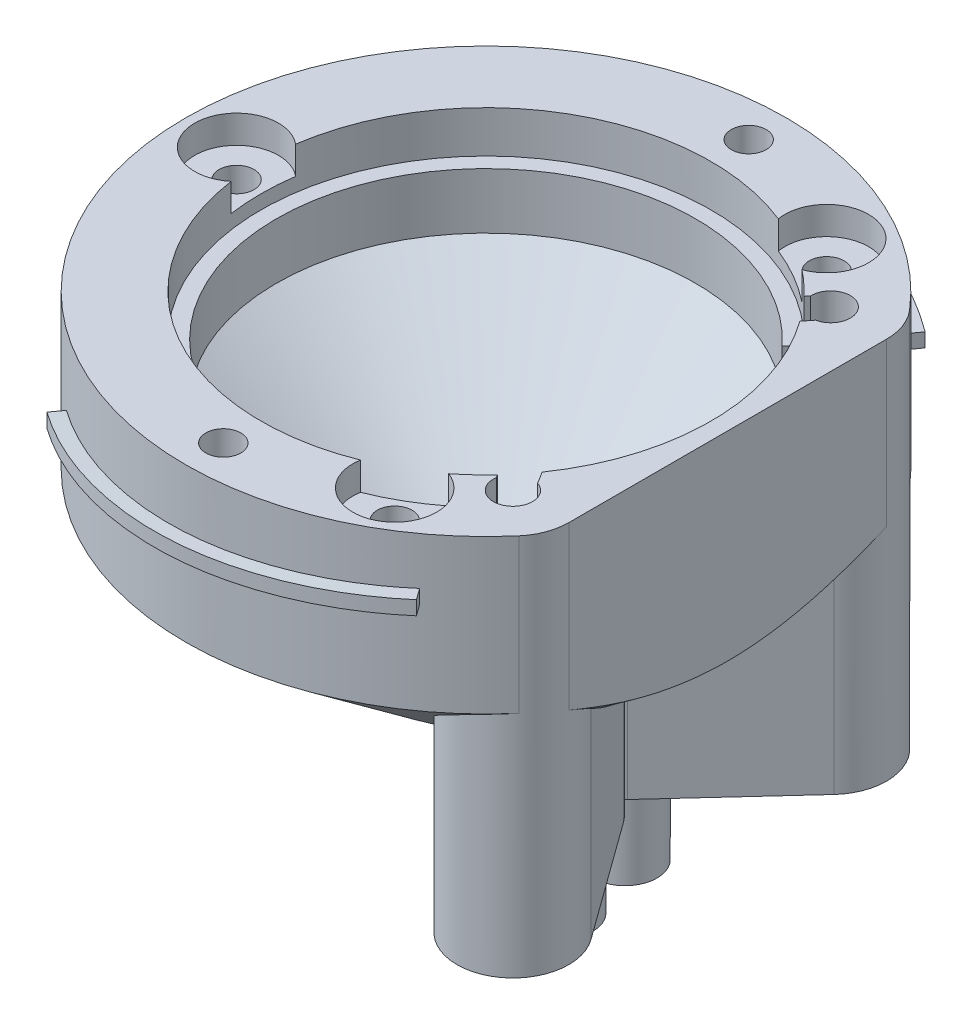
from build123d import *
from build123d.topology import SkipClean

# Parameters (mm, degrees)
CANNULA_SLEEVE_INNER_DIA_R    = 1.145
CANNULA_SLEEVE_INNER_DIA_R_2  = 0.345
OUTPUT_CANNULA_SLEEVE_DEPTH   = 4
OUTPUT_CANNULA_SLEEVE_2_DEPTH = 4
SKETCH3_R                     = 0.345
BOSS_EXTRUDE1_DEPTH           = 1
SKETCH5_R                     = 0.7
CUT_EXTRUDE1_DEPTH            = 0.25
SKETCH28_R                    = 0.5
SKETCH28_R_2                  = 0.345
BOSS_EXTRUDE9_DEPTH           = 2
BOSS_EXTRUDE3_DEPTH           = 3.5
BOSS_EXTRUDE8_START           = -1.2
BOSS_EXTRUDE8_DEPTH           = 0.8
CUT_EXTRUDE2_START            = 1.999997
SKETCH4_R                     = 0.7
SKETCH4_R_2                   = 0.345
CUT_EXTRUDE2_DEPTH            = 5.493648
BOSS_EXTRUDE5_REACH           = 27.822
SKETCH16_R                    = 8.05
CUT_EXTRUDE5_DEPTH            = 1.5
CUT_EXTRUDE12_DEPTH           = 26.821834534
BOSS_EXTRUDE12_DEPTH          = 5.5
BOSS_EXTRUDE10_DEPTH          = 0.6
CUT_EXTRUDE4_REACH            = 30.007
SKETCH18_2_R                  = 0.625
SKETCH18_R                    = 1.5
SKETCH18_R_2                  = 0.625
CUT_EXTRUDE10_DEPTH           = 1
CIRPATTERN1_COUNT             = 3
SWEEP1_PITCH                  = 4
CIRPATTERN4_COUNT             = 2
FILLET1_R                     = 1
FILLET2_R                     = 1
CUT_SWEEP3_PITCH              = 4
CUT_SWEEP3_TO                 = 2.5
CIRPATTERN5_COUNT             = 2
CUT_REVOLVE1_START            = -14
CUT_REVOLVE1_DEPTH            = 19.502847315
CIRPATTERN6_COUNT             = 4
SKETCH50_R                    = 0.625
CUT_EXTRUDE13_DEPTH           = 3.5
BOSS_EXTRUDE13_DEPTH          = 5
SKETCH50_2_R                  = 0.625
CUT_EXTRUDE16_DEPTH           = 5
SKETCH52_R                    = 1.5
CUT_EXTRUDE17_DEPTH           = 3.5
BOSS_EXTRUDE14_DEPTH          = 3
SKETCH55_R                    = 4.475
SKETCH55_R_2                  = 3.475
EXTRUDE_THIN4_DEPTH           = 20


with BuildPart() as part:
    # cannula sleeve inner dia → Output cannula sleeve (new body)
    with BuildSketch(Plane(origin=(0, 0, 0), x_dir=(1, 0, 0), z_dir=(0, 1, 0))):
        with Locations((-5.5, 1.4)):
            Circle(CANNULA_SLEEVE_INNER_DIA_R)
        with Locations((-5.5, 1.4)):
            Circle(CANNULA_SLEEVE_INNER_DIA_R_2, mode=Mode.SUBTRACT)
    extrude(amount=-OUTPUT_CANNULA_SLEEVE_DEPTH)



with BuildPart() as body_2:
    # cannula sleeve inner dia → Output cannula sleeve 2 (new body)
    with BuildSketch(Plane(origin=(0, 0, 0), x_dir=(1, 0, 0), z_dir=(0, 1, 0))):
        with Locations((-5, -1.4)):
            Circle(CANNULA_SLEEVE_INNER_DIA_R)
        with Locations((-5, -1.4)):
            Circle(CANNULA_SLEEVE_INNER_DIA_R_2, mode=Mode.SUBTRACT)
    extrude(amount=-OUTPUT_CANNULA_SLEEVE_2_DEPTH)


with BuildPart() as part_1:
    add(part.part)

    add(body_2.part)  # Boss-Extrude1 merges body 2
    # Sketch3 → Boss-Extrude1 (add)
    # profile 1 of 2: a face of its own
    with BuildSketch(Plane(origin=(0, 0, 0), x_dir=(1, 0, 0), z_dir=(0, 1, 0))):
        with BuildLine():
            Line((-3.906995396, 6.631857239), (-6.833881294, 2.301587874))
            ThreePointArc((-6.833881294, 2.301587874), (-6.498343411, 0.136904424), (-4.314693548, 0.310436502))
            Line((-4.314693548, 0.310436502), (-0.777569625, 4.158377274))
            ThreePointArc((-0.777569625, 4.158377274), (-1.009821849, 7.080935129), (-3.906995396, 6.631857239))
        make_face()
        with Locations(Location((-5.5, 1.4, 0), (0, 0, 270))):
            Circle(SKETCH3_R, mode=Mode.SUBTRACT)
    # profile 2 of 2: a face of its own
    with BuildSketch(Plane(origin=(0, 0, 0), x_dir=(1, 0, 0), z_dir=(0, 1, 0))):
        with BuildLine():
            Line((-6.429640476, -2.140424276), (-4.025950902, -6.781563173))
            ThreePointArc((-4.025950902, -6.781563173), (-1.200618488, -7.564367275), (-0.6302195, -4.688618588))
            Line((-0.6302195, -4.688618588), (-3.696076698, -0.455603885))
            ThreePointArc((-3.696076698, -0.455603885), (-5.844752117, -0.029418423), (-6.429640476, -2.140424276))
        make_face()
        with Locations(Location((-5, -1.4, 0), (0, 0, 270))):
            Circle(SKETCH3_R, mode=Mode.SUBTRACT)
    extrude(amount=-BOSS_EXTRUDE1_DEPTH)

    # Sketch5 → Cut-Extrude1 (cut)
    with BuildSketch(Plane(origin=(0, 0, 0), x_dir=(1, 0, 0), z_dir=(0, 1, 0))):
        with Locations(Location((-2.25, 5.511872303, 0), (0, 0, 270))):
            Circle(SKETCH5_R)
        with Locations(Location((-2.25, -5.861781464, 0), (0, 0, 270))):
            Circle(SKETCH5_R)
    extrude(amount=-CUT_EXTRUDE1_DEPTH, mode=Mode.SUBTRACT)


with BuildPart() as body_2_2:
    # Sketch28 → Boss-Extrude9 (new body)
    with BuildSketch(Plane(origin=(0, 0, 0), x_dir=(1, 0, 0), z_dir=(0, 1, 0))):
        with BuildLine():
            ThreePointArc((-6.253932905, 1.909593146), (-6.064281059, 0.686076414), (-4.830044179, 0.784159762))
            add(Edge.make_bspline(
                [(-4.830044179, 0.784159762), (-2.987860699, 2.640455397), (-1.292920256, 4.632100534)],
                knots=[0, 0, 0, 1, 1, 1], degree=2))
            ThreePointArc((-1.292920256, 4.632100534), (-1.443884202, 6.53176314), (-3.327047008, 6.239862511))
            add(Edge.make_bspline(
                [(-3.327047008, 6.239862511), (-4.873339726, 4.130727075), (-6.253932905, 1.909593146)],
                knots=[0, 0, 0, 1, 1, 1], degree=2))
        make_face()
        with Locations(Location((-2.25, 5.511872303, 0), (0, 0, 270))):
            Circle(SKETCH28_R, mode=Mode.SUBTRACT)
        with Locations(Location((-5.5, 1.4, 0), (0, 0, 270))):
            Circle(SKETCH28_R_2, mode=Mode.SUBTRACT)
        with BuildLine():
            ThreePointArc((-5.362892315, 2.335000793), (-4.914015824, 2.141382186), (-4.621951834, 1.749365738))
            add(Edge.make_bspline(
                [(-4.621951834, 1.749365738), (-3.392727323, 2.938689432), (-2.311022612, 4.263362695)],
                knots=[0, 0, 0, 1, 1, 1], degree=2))
            ThreePointArc((-2.311022612, 4.263362695), (-3.025111344, 4.531208036), (-3.45065336, 5.164120223))
            add(Edge.make_bspline(
                [(-5.362892315, 2.335000793), (-4.489654602, 3.805694386), (-3.45065336, 5.164120223)],
                knots=[0, 0, 0, 1, 1, 1], degree=2))
        make_face(mode=Mode.SUBTRACT)
    extrude(amount=BOSS_EXTRUDE9_DEPTH)


with BuildPart() as body_2_3:
    # Top-frame → Boss-Extrude3 (new body)
    with BuildSketch(Plane(origin=(0, 9.2, 0), x_dir=(0.9996206134813869, 0, -0.027543222453005226), z_dir=(0, 1, 0))):
        with BuildLine():
            Line((-0.098090428, 5.516666978), (-0.411357504, -5.852671777))
            ThreePointArc((-0.411357504, -5.852671777), (-0.554226724, -6.541818475), (-0.92697735, -7.138804031))
            ThreePointArc((-0.92697735, -7.138804031), (-19.647363868, 0.366336116), (-0.542106371, 6.829240726))
            ThreePointArc((-0.542106371, 6.829240726), (-0.202794639, 6.212635233), (-0.098090428, 5.516666978))
        make_face()
        with BuildLine():
            Line((-3.262093165, 5.014712233), (-2.797330609, 5.570543294))
            ThreePointArc((-2.797330609, 5.570543294), (-1.648308014, 6.108761588), (-1.974586368, 4.882599163))
            Line((-1.974586368, 4.882599163), (-2.598990166, 4.135845747))
            ThreePointArc((-2.598990166, 4.135845747), (-1.402302135, -0.043319323), (-2.724989618, -4.184331366))
            Line((-2.724989618, -4.184331366), (-2.171978308, -5.139512165))
            ThreePointArc((-2.171978308, -5.139512165), (-2.059867689, -6.40338046), (-3.10011029, -5.676863296))
            Line((-3.10011029, -5.676863296), (-3.447081028, -5.0775631))
            ThreePointArc((-3.447081028, -5.0775631), (-16.40018268, 0.207695753), (-3.262093165, 5.014712233))
        make_face(mode=Mode.SUBTRACT)
    extrude(amount=BOSS_EXTRUDE3_DEPTH)

    # Sketch27 → Boss-Extrude8 (add)
    with BuildSketch(Plane(origin=(0, 12.7, 0), x_dir=(1, 0, 0), z_dir=(0, 1, 0)).offset(BOSS_EXTRUDE8_START)):
        with BuildLine():
            Line((-2.749785752, 5.497236662), (-2.949700053, 5.491382405))
            ThreePointArc((-2.949700053, 5.491382405), (-1.815937647, 6.061044292), (-2.108319751, 4.826360299))
            Line((-2.108319751, 4.826360299), (-2.148799822, 5.022220871))
            ThreePointArc((-2.148799822, 5.022220871), (-1.939955462, 5.904138009), (-2.749785752, 5.497236662))
        make_face()
        with BuildLine():
            Line((-2.75, -5.861781464), (-2.95, -5.861781464))
            ThreePointArc((-2.95, -5.861781464), (-1.840294683, -6.429356616), (-2.029595562, -5.197385585))
            Line((-2.029595562, -5.197385585), (-2.092568259, -5.387212979))
            ThreePointArc((-2.092568259, -5.387212979), (-1.957353345, -6.267192287), (-2.75, -5.861781464))
        make_face()
    extrude(amount=-BOSS_EXTRUDE8_DEPTH)

    # Sketch15 → Revolve3 (revolve)
    with SkipClean():  # the faces are left unmerged after this step: merging them gives an invalid solid
        with BuildSketch(Plane.XY.offset(0.174954581), mode=Mode.PRIVATE) as revolve3_sk:
            Polygon((-19.65, 7.2), (-19.65, 9.2), (-19.05, 9.2), (-19.05, 7.493644806), (-12.751373873, 2.6), (-8.9, 2.6), (-8.9, 2), (-12.957063107, 2), align=None)
        revolve(revolve3_sk.sketch.rotate(Axis((-8.9, 2.6, 0.174954581), (0, -1, 0)), 90), axis=Axis((-8.9, 2.6, 0.174954581), (0, -1, 0)))

    # Sketch4 → Cut-Extrude2 (cut)
    # profile 1 of 4: a face of its own
    with SkipClean():  # the faces are left unmerged after this step: merging them gives an invalid solid
        with BuildSketch(Plane(origin=(0, 0, 0), x_dir=(1, 0, 0), z_dir=(0, 1, 0)).offset(CUT_EXTRUDE2_START)):
            with BuildLine():
                Line((-3.409896777, 6.295861758), (-6.336782675, 1.965592393))
                ThreePointArc((-6.336782675, 1.965592393), (-6.126289966, 0.607623272), (-4.756422661, 0.716485011))
                Line((-4.756422661, 0.716485011), (-1.219298738, 4.564425783))
                ThreePointArc((-1.219298738, 4.564425783), (-1.381875295, 6.610216281), (-3.409896777, 6.295861758))
            make_face()
            with Locations(Location((-2.25, 5.511872303, 0), (0, 0, 270))):
                Circle(SKETCH4_R, mode=Mode.SUBTRACT)
            with Locations(Location((-5.5, 1.4, 0), (0, 0, 270))):
                Circle(SKETCH4_R_2, mode=Mode.SUBTRACT)
        # profile 2 of 4: a face of its own
        with BuildSketch(Plane(origin=(0, 0, 0), x_dir=(1, 0, 0), z_dir=(0, 1, 0)).offset(CUT_EXTRUDE2_START)):
            with Locations(Location((-5.5, 1.4, 0), (0, 0, 270))):
                Circle(SKETCH4_R_2)
        # profile 3 of 4: a face of its own
        with BuildSketch(Plane(origin=(0, 0, 0), x_dir=(1, 0, 0), z_dir=(0, 1, 0)).offset(CUT_EXTRUDE2_START)):
            with Locations(Location((-2.25, 5.511872303, 0), (0, 0, 270))):
                Circle(SKETCH4_R)
        # profile 4 of 4: a face of its own
        with BuildSketch(Plane(origin=(0, 0, 0), x_dir=(1, 0, 0), z_dir=(0, 1, 0)).offset(CUT_EXTRUDE2_START)):
            with BuildLine():
                Line((-5.896855206, -1.864489763), (-3.493165632, -6.50562866))
                ThreePointArc((-3.493165632, -6.50562866), (-1.515432942, -7.053591531), (-1.11615365, -5.040567451))
                Line((-1.11615365, -5.040567451), (-4.182010848, -0.807552748))
                ThreePointArc((-4.182010848, -0.807552748), (-5.529937664, -0.540194166), (-5.896855206, -1.864489763))
            make_face()
        extrude(amount=CUT_EXTRUDE2_DEPTH, mode=Mode.SUBTRACT)

    # Sketch4<3> → Boss-Extrude5 (add, up to next)
    with BuildSketch(Plane(origin=(0, 0, 0), x_dir=(1, 0, 0), z_dir=(0, 1, 0)), mode=Mode.PRIVATE) as boss_extrude5_sk1:
        with BuildLine():
            ThreePointArc((-0.777569625, 4.158377274), (-1.009821849, 7.080935129), (-3.906995396, 6.631857239))
            Line((-3.906995396, 6.631857239), (-6.833881294, 2.301587874))
            ThreePointArc((-6.833881294, 2.301587874), (-7.021758294, 0.874308364), (-5.992965694, -0.132672445))
            ThreePointArc((-5.992965694, -0.132672445), (-5.283022928, 0.184928397), (-4.507034306, 0.132672445))
            ThreePointArc((-4.507034306, 0.132672445), (-4.407243211, 0.217636858), (-4.314693548, 0.310436502))
            Line((-4.314693548, 0.310436502), (-0.777569625, 4.158377274))
        make_face()
        with BuildLine():
            Line((-6.336782675, 1.965592393), (-3.409896777, 6.295861758))
            ThreePointArc((-3.409896777, 6.295861758), (-1.381875295, 6.610216281), (-1.219298738, 4.564425783))
            Line((-1.219298738, 4.564425783), (-4.756422661, 0.716485011))
            ThreePointArc((-4.756422661, 0.716485011), (-6.126289966, 0.607623272), (-6.336782675, 1.965592393))
        make_face(mode=Mode.SUBTRACT)
    boss_extrude5_tool1 = extrude(boss_extrude5_sk1.sketch, amount=BOSS_EXTRUDE5_REACH, mode=Mode.PRIVATE) - body_2_3.part
    # Sketch4<3> → Boss-Extrude5 (add, up to next)
    with BuildSketch(Plane(origin=(0, 0, 0), x_dir=(1, 0, 0), z_dir=(0, 1, 0)), mode=Mode.PRIVATE) as boss_extrude5_sk2:
        with BuildLine():
            ThreePointArc((-4.507034306, 0.132672445), (-5.216977072, -0.184928397), (-5.992965694, -0.132672445))
            ThreePointArc((-5.992965694, -0.132672445), (-6.57322027, -1.057833399), (-6.429640476, -2.140424276))
            Line((-6.429640476, -2.140424276), (-4.025950902, -6.781563173))
            ThreePointArc((-4.025950902, -6.781563173), (-1.200618488, -7.564367275), (-0.6302195, -4.688618588))
            Line((-0.6302195, -4.688618588), (-3.696076698, -0.455603885))
            ThreePointArc((-3.696076698, -0.455603885), (-4.054632465, -0.096780823), (-4.507034306, 0.132672445))
        make_face()
        with BuildLine():
            Line((-4.182010848, -0.807552748), (-1.11615365, -5.040567451))
            ThreePointArc((-1.11615365, -5.040567451), (-1.515432942, -7.053591531), (-3.493165632, -6.50562866))
            Line((-3.493165632, -6.50562866), (-5.896855206, -1.864489763))
            ThreePointArc((-5.896855206, -1.864489763), (-5.529937664, -0.540194166), (-4.182010848, -0.807552748))
        make_face(mode=Mode.SUBTRACT)
    boss_extrude5_tool2 = extrude(boss_extrude5_sk2.sketch, amount=BOSS_EXTRUDE5_REACH, mode=Mode.PRIVATE) - body_2_3.part
    # Sketch4<3> → Boss-Extrude5 (add, up to next)
    with BuildSketch(Plane(origin=(0, 0, 0), x_dir=(1, 0, 0), z_dir=(0, 1, 0)), mode=Mode.PRIVATE) as boss_extrude5_sk3:
        with BuildLine():
            ThreePointArc((-4.507034306, 0.132672445), (-5.283022928, 0.184928397), (-5.992965694, -0.132672445))
            ThreePointArc((-5.992965694, -0.132672445), (-5.216977072, -0.184928397), (-4.507034306, 0.132672445))
        make_face()
    boss_extrude5_tool3 = extrude(boss_extrude5_sk3.sketch, amount=BOSS_EXTRUDE5_REACH, mode=Mode.PRIVATE) - body_2_3.part

    add(part_1.part)  # Boss-Extrude5 merges part
    add(boss_extrude5_tool1.solids().sort_by_distance((-2.62175, 0, -2.303917))[0])
    add(boss_extrude5_tool2.solids().sort_by_distance((-5.199019, 0, 0.285495))[0])
    add(boss_extrude5_tool3.solids().sort_by_distance((-5.25, 0, 0))[0])

    # Sketch16 → Cut-Extrude5 (cut)
    with BuildSketch(Plane(origin=(0, 12.7, 0), x_dir=(1, 0, 0), z_dir=(0, 1, 0))):
        with Locations((-8.9, -0.174954581)):
            Circle(SKETCH16_R)
    extrude(amount=-CUT_EXTRUDE5_DEPTH, mode=Mode.SUBTRACT)

    # Sketch29 → Cut-Extrude12 (cut, through all)
    with SkipClean():  # the faces are left unmerged after this step: merging them gives an invalid solid
        with BuildSketch(Plane(origin=(0, 0, 0), x_dir=(1, 0, 0), z_dir=(0, 1, 0))):
            with BuildLine():
                Line((-0.25, 5.511872303), (-0.25, -5.861781464))
                ThreePointArc((-0.25, -5.861781464), (-0.373833696, -6.554601787), (-0.73, -7.161627609))
                ThreePointArc((-0.73, -7.161627609), (1.85, -0.174954581), (-0.73, 6.811718447))
                ThreePointArc((-0.73, 6.811718447), (-0.373833696, 6.204692626), (-0.25, 5.511872303))
            make_face()
        extrude(amount=CUT_EXTRUDE12_DEPTH, mode=Mode.SUBTRACT)

    # Sketch34 → Boss-Extrude12 (add)
    with SkipClean():  # the faces are left unmerged after this step: merging them gives an invalid solid
        with BuildSketch(Plane(origin=(0, 12.7, 0), x_dir=(1, 0, 0), z_dir=(0, 1, 0))):
            with BuildLine():
                Line((-0.85, -7.29006715), (-0.85, 6.940157988))
                ThreePointArc((-0.85, 6.940157988), (-0.406091109, 6.286468972), (-0.25, 5.511872303))
                Line((-0.25, 5.511872303), (-0.25, -5.861781464))
                ThreePointArc((-0.25, -5.861781464), (-0.406091109, -6.636378133), (-0.85, -7.29006715))
            make_face()
        extrude(amount=-BOSS_EXTRUDE12_DEPTH)

    # Sketch30 → Boss-Extrude10 (add)
    with BuildSketch(Plane(origin=(-0.25, 0, 0), x_dir=(0, 0, -1), z_dir=(1, 0, 0))):
        with BuildLine():
            Line((5.511872303, 6.890725811), (5.511872303, 12.7))
            Line((5.511872303, 12.7), (-5.861781464, 12.7))
            Line((-5.861781464, 12.7), (-5.861781464, 6.890725811))
            add(Edge.make_bspline(
                [(-5.861781464, 6.890725811), (-4.974776423, 6.512142652), (-4.066495113, 6.18428297), (-2.883499387, 5.888043781), (-2.644474102, 5.834579958), (-2.160877794, 5.740873574), (-1.915230094, 5.7005069), (-1.177608351, 5.602943897), (-0.195837008, 5.535878017), (0.782369313, 5.599102274), (1.758883738, 5.724159879), (2.249116283, 5.818396594), (3.687529964, 6.174026644), (4.609959408, 6.505779822), (5.511872303, 6.890725811)],
                knots=[0, 0, 0, 0, 0.25, 0.25, 0.3125, 0.3125, 0.375, 0.375, 0.5, 0.625, 0.625, 0.75, 0.75, 1, 1, 1, 1], degree=3))
        make_face()
    extrude(amount=-BOSS_EXTRUDE10_DEPTH)

    # Sketch18<2> → Cut-Extrude4 (cut, up to next)
    with BuildSketch(Plane(origin=(0, 12.7, 0), x_dir=(1, 0, 0), z_dir=(0, 1, 0)), mode=Mode.PRIVATE) as cut_extrude4_sk1:
        with Locations(Location((-4.4375, 7.554322148, 0), (0, 0, 270))):
            Circle(SKETCH18_2_R)
    cut_extrude4_tool1 = extrude(cut_extrude4_sk1.sketch, amount=-CUT_EXTRUDE4_REACH, mode=Mode.PRIVATE) & body_2_3.part
    cut_extrude4 = cut_extrude4_tool1.solids().sort_by_distance((-4.4375, 12.7, -7.554322))[0]
    add(cut_extrude4, mode=Mode.SUBTRACT)

    # Sketch18 → Cut-Extrude10 (cut)
    with BuildSketch(Plane(origin=(0, 12.7, 0), x_dir=(1, 0, 0), z_dir=(0, 1, 0))):
        with Locations((-4.4375, 7.554322148)):
            Circle(SKETCH18_R)
        with Locations(Location((-4.4375, 7.554322148, 0), (0, 0, 270))):
            Circle(SKETCH18_R_2, mode=Mode.SUBTRACT)
    cut_extrude10 = extrude(amount=-CUT_EXTRUDE10_DEPTH, mode=Mode.SUBTRACT)

    # CirPattern1: Cut-Extrude4, Cut-Extrude10 ×3 about axis
    cirpattern1_axis = Axis((-8.9, 0, 0.174954581), (0, 1, 0))
    add([cut_extrude4.rotate(cirpattern1_axis, i * 360 / CIRPATTERN1_COUNT) for i in range(1, CIRPATTERN1_COUNT)], mode=Mode.SUBTRACT)
    add([cut_extrude10.rotate(cirpattern1_axis, i * 360 / CIRPATTERN1_COUNT) for i in range(1, CIRPATTERN1_COUNT)], mode=Mode.SUBTRACT)

    # Sweep1: arcs per turn and ends read off the stored shape
    # Sweep1: the profile of Sketch40 screwed along a right-hand helix through 0.2 turns, 12 arcs to a turn; built about Z, then put on its axis
    sweep1_z = Axis((0, 0, 0), (0, 0, 1))
    sweep1_corners = [(10.75, 0, 1), (11.25, 0, 1), (11.25, 0, 0.5), (10.75, 0, 0.5), (10.05, 0, 0.5), (10.05, 0, 1)]
    with BuildLine(mode=Mode.PRIVATE) as sweep1_profile:
        Line(sweep1_corners[0], sweep1_corners[1])
        Line(sweep1_corners[1], sweep1_corners[2])
        Line(sweep1_corners[2], sweep1_corners[3])
        Line(sweep1_corners[3], sweep1_corners[4])
        Line(sweep1_corners[4], sweep1_corners[5])
        Line(sweep1_corners[5], sweep1_corners[0])
    sweep1_cap = Face(sweep1_profile.wire())
    sweep1_turn_angles = [0, 15, 30, 45, 60, 66, 72]
    sweep1_turn_weights = [1, 0.9659258262890683, 1, 0.9659258262890683, 1, 0.9945218953682732, 1]
    sweep1_turn_rails = [Edge.make_bspline([Vector(p[0], p[1], 0).rotate(sweep1_z, sweep1_turn_angles[k]) / sweep1_turn_weights[k] + Vector(0, 0, p[2] + SWEEP1_PITCH * sweep1_turn_angles[k] / 360) for k in range(7)], [0, 0, 0, 1, 1, 2, 2, 3, 3, 3], 2, sweep1_turn_weights) for p in sweep1_corners]
    sweep1_turn_sides = [Face.make_surface_from_curves(sweep1_turn_rails[p[0]], sweep1_turn_rails[p[1]]) for p in [(0, 1), (1, 2), (2, 3), (3, 4), (4, 5), (5, 0)]]
    sweep1 = Plane(origin=(-8.9, 9.2, 0.174954581), x_dir=(0.5877852522924744, 0, -0.8090169943749467), z_dir=(0, 1, 0)) * Solid(Shell([*sweep1_turn_sides, sweep1_cap, sweep1_cap.rotate(sweep1_z, 72).moved(Location((0, 0, SWEEP1_PITCH * 72 / 360)))]))
    add(sweep1)

    # CirPattern4: Sweep1 ×2 about axis
    cirpattern4_axis = Axis((-8.9, 12.7, 0.174954581), (0, -1, 0))
    for i in range(1, CIRPATTERN4_COUNT):
        add(sweep1.rotate(cirpattern4_axis, i * 360 / CIRPATTERN4_COUNT))

    # Sketch50 → Cut-Extrude13 (cut)
    with BuildSketch(Plane(origin=(0, 12.7, 0), x_dir=(1, 0, 0), z_dir=(0, 1, 0))):
        with Locations(Location((-8.9, 9.225045419, 0), (0, 0, 270))):
            Circle(SKETCH50_R)
    cut_extrude13 = extrude(amount=-CUT_EXTRUDE13_DEPTH, mode=Mode.SUBTRACT)

    # Mirror1: Cut-Extrude13 across plane
    add(cut_extrude13.mirror(Plane.XY.offset(0.174954581)), mode=Mode.SUBTRACT)


with BuildPart() as body_2_4:
    # Sketch45 → Revolve4 (revolve)
    with BuildSketch(Plane(origin=(-8.9, 0, 0), x_dir=(0, 0, -1), z_dir=(1, 0, 0))):
        Polygon((-13.910101767, 11.7), (-11.614954581, 9.404852814), (-11.614954581, 8.72), (-12.474954581, 8.72), (-12.474954581, 8.18), (-11.614954581, 8.18), (-11.614954581, 7.495147186), (-12.494954581, 6.615147186), (-12.494954581, -14), (-10.994954581, -14), (-10.994954581, 6.700933624), (-10.969693488, 6.726194716), (-11.024954581, 11.7), align=None)
    revolve(axis=Axis((-8.9, 13.106847712, 0.174954581), (0, -1, 0)))

    # Fillet1
    fillet1_edges = [body_2_4.edges().sort_by_distance(p)[0] for p in [
        (-8.9, 11.7, -13.560192606),
    ]]
    fillet(fillet1_edges, radius=FILLET1_R)

    # Fillet2
    # the kernel refuses this fillet: 1 mm, written as the material it adds along each edge
    with BuildSketch(Plane(origin=(-8.9, 6.700933624, 0.174954581), x_dir=(0, 0, 1), z_dir=(1, 0, 0))) as fillet2_piece_1:
        with BuildLine():
            CenterArc((9.82, 0.198086309), FILLET2_R, 347.094281556, 12.905718444)
            Line((10.82, 0.198086309), (10.82, 0))
            Line((10.82, 0), (10.794738908, -0.025261092))
        make_face()
    revolve(axis=Axis((-8.9, 6.700933624, 0.174954581), (0, -1, 0)))
    # the kernel refuses this fillet: 1 mm, written as the material it takes off along each edge
    with BuildSketch(Plane(origin=(-8.9, 6.615147186, 0.174954581), x_dir=(0, 0, 1), z_dir=(1, 0, 0))) as fillet2_2_piece_1:
        with BuildLine():
            CenterArc((12.32 - FILLET2_R, FILLET2_R * 0.414213562373), FILLET2_R, 315, 45)
            Line((12.32, FILLET2_R * 0.414213562373), (12.32, 0))
            Line((12.32, 0), (12.32 - FILLET2_R * 0.292893218813, -FILLET2_R * 0.292893218813))
        make_face()
    revolve(axis=Axis((-8.9, 6.615147186, 0.174954581), (0, -1, 0)), mode=Mode.SUBTRACT)

    # Cut-Sweep3: arcs per turn and ends read off the stored shape
    # Cut-Sweep3: the profile of Sketch48 screwed along a right-hand helix through 1 turns, 12 arcs to a turn; built about Z, then put on its axis
    cut_sweep3_z = Axis((0, 0, 0), (0, 0, 1))
    cut_sweep3_corners = [(9.717458757, -0.000140769, 1.009990778), (11.349999999, -0.000164419, 1.009990778), (11.349999999, -0.000164419, 0.349990778), (9.717458757, -0.000140769, 0.349990778)]
    with BuildLine(mode=Mode.PRIVATE) as cut_sweep3_profile:
        Line(cut_sweep3_corners[0], cut_sweep3_corners[1])
        Line(cut_sweep3_corners[1], cut_sweep3_corners[2])
        Line(cut_sweep3_corners[2], cut_sweep3_corners[3])
        Line(cut_sweep3_corners[3], cut_sweep3_corners[0])
    cut_sweep3_cap = Face(cut_sweep3_profile.wire())
    cut_sweep3_turn_angles = [0, 15, 30, 45, 60, 75, 90, 105, 120, 135, 150, 165, 180, 195, 210, 225, 240, 255, 270, 285, 300, 315, 330, 345, 360]
    cut_sweep3_turn_weights = [1, 0.9659258262890683, 1, 0.9659258262890683, 1, 0.9659258262890683, 1, 0.9659258262890683, 1, 0.9659258262890683, 1, 0.9659258262890683, 1, 0.9659258262890683, 1, 0.9659258262890683, 1, 0.9659258262890683, 1, 0.9659258262890683, 1, 0.9659258262890683, 1, 0.9659258262890683, 1]
    cut_sweep3_turn_rails = [Edge.make_bspline([Vector(p[0], p[1], 0).rotate(cut_sweep3_z, cut_sweep3_turn_angles[k]) / cut_sweep3_turn_weights[k] + Vector(0, 0, p[2] + CUT_SWEEP3_PITCH * cut_sweep3_turn_angles[k] / 360) for k in range(25)], [0, 0, 0, 1, 1, 2, 2, 3, 3, 4, 4, 5, 5, 6, 6, 7, 7, 8, 8, 9, 9, 10, 10, 11, 11, 12, 12, 12], 2, cut_sweep3_turn_weights) for p in cut_sweep3_corners]
    cut_sweep3_turn_sides = [Face.make_surface_from_curves(cut_sweep3_turn_rails[p[0]], cut_sweep3_turn_rails[p[1]]) for p in [(0, 1), (1, 2), (2, 3), (3, 0)]]
    cut_sweep3 = Plane(origin=(-8.9, 9.2, 0.174954581), x_dir=(0.5877852522924742, 0, -0.8090169943749467), z_dir=(0, 1, 0)) * split(Solid(Shell([*cut_sweep3_turn_sides, cut_sweep3_cap, cut_sweep3_cap.rotate(cut_sweep3_z, 360).moved(Location((0, 0, CUT_SWEEP3_PITCH * 360 / 360)))])), bisect_by=Plane.XY.offset(CUT_SWEEP3_TO), keep=Keep.BOTTOM, mode=Mode.PRIVATE)
    add(cut_sweep3, mode=Mode.SUBTRACT)

    # CirPattern5: Cut-Sweep3 ×2 about axis
    cirpattern5_axis = Axis((-8.9, 11.7, 0.174954581), (0, 1, 0))
    for i in range(1, CIRPATTERN5_COUNT):
        add(cut_sweep3.rotate(cirpattern5_axis, i * 360 / CIRPATTERN5_COUNT), mode=Mode.SUBTRACT)

    # Cut-Revolve1: read off the stored shape, not the designer's step
    # Cut-Revolve1 outline → Cut-Revolve1 (cut)
    with BuildSketch(Plane(origin=(0, 0, 0), x_dir=(1, 0, 0), z_dir=(0, 1, 0)).offset(CUT_REVOLVE1_START)):
        with BuildLine():
            ThreePointArc((-2.693902959, -9.0381797), (-8.9, -10.994954581), (-15.106097041, -9.0381797))
            Line((-15.106097041, -9.0381797), (-15.966461696, -10.266907766))
            ThreePointArc((-15.966461696, -10.266907766), (-8.9, -12.494954581), (-1.833538304, -10.266907766))
            Line((-1.833538304, -10.266907766), (-2.693902959, -9.0381797))
        make_face()
    cut_revolve1 = extrude(amount=CUT_REVOLVE1_DEPTH, mode=Mode.SUBTRACT)

    # CirPattern6: Cut-Revolve1 ×4 about axis
    cirpattern6_axis = Axis((-8.9, 8.18, 0.174954581), (0, 1, 0))
    for i in range(1, CIRPATTERN6_COUNT):
        add(cut_revolve1.rotate(cirpattern6_axis, i * 360 / CIRPATTERN6_COUNT), mode=Mode.SUBTRACT)


with BuildPart() as body_2_5:
    # Sketch51 → Boss-Extrude13 (new body)
    with BuildSketch(Plane(origin=(0, 12.7, 0), x_dir=(1, 0, 0), z_dir=(0, 1, 0))):
        with BuildLine():
            Line((-14.275, 9.13481851), (-12.925, 6.79654992))
            ThreePointArc((-12.925, 6.79654992), (-8.9, 7.875045419), (-4.875, 6.79654992))
            Line((-4.875, 6.79654992), (-3.525, 9.13481851))
            ThreePointArc((-3.525, 9.13481851), (-8.9, 10.575045419), (-14.275, 9.13481851))
        make_face()
    extrude(amount=BOSS_EXTRUDE13_DEPTH)

    # Sketch50<2> → Cut-Extrude16 (cut)
    with BuildSketch(Plane(origin=(0, 12.7, 0), x_dir=(1, 0, 0), z_dir=(0, 1, 0))):
        with Locations(Location((-8.9, 9.225045419, 0), (0, 0, 270))):
            Circle(SKETCH50_2_R)
    extrude(amount=CUT_EXTRUDE16_DEPTH, mode=Mode.SUBTRACT)

    # Sketch52 → Cut-Extrude17 (cut)
    with BuildSketch(Plane(origin=(0, 17.7, 0), x_dir=(1, 0, 0), z_dir=(0, 1, 0))):
        with Locations((-8.9, 9.225045419)):
            Circle(SKETCH52_R)
    extrude(amount=-CUT_EXTRUDE17_DEPTH, mode=Mode.SUBTRACT)


with BuildPart() as body_3:
    # Mirror3: mirrored copy
    add(body_2_5.part.mirror(Plane.XY.offset(0.174954581)))


with BuildPart() as body_2_5_1:
    with SkipClean():  # the faces are left unmerged after this step: merging them gives an invalid solid
        add(body_2_5.part)

        add(body_3.part)  # Boss-Extrude14 merges body 3
        # Sketch53 → Boss-Extrude14 (add)
        with BuildSketch(Plane(origin=(0, 17.7, 0), x_dir=(1, 0, 0), z_dir=(0, 1, 0))):
            with BuildLine():
                Line((-14.275, 9.13481851), (-13.375, -0.174954581))
                Line((-13.375, -0.174954581), (-14.275, -9.484727671))
                ThreePointArc((-14.275, -9.484727671), (-12.461642258, -10.317794638), (-10.525550844, -10.801340818))
                Line((-10.525550844, -10.801340818), (-9.919503883, -4.532274495))
                ThreePointArc((-9.919503883, -4.532274495), (-8.9, -4.649954581), (-7.880496117, -4.532274495))
                Line((-7.880496117, -4.532274495), (-7.274449156, -10.801340818))
                ThreePointArc((-7.274449156, -10.801340818), (-5.338357742, -10.317794638), (-3.525, -9.484727671))
                Line((-3.525, -9.484727671), (-4.425, -0.174954581))
                Line((-4.425, -0.174954581), (-3.525, 9.13481851))
                ThreePointArc((-3.525, 9.13481851), (-5.338357742, 9.967885476), (-7.274449156, 10.451431656))
                Line((-7.274449156, 10.451431656), (-7.880496117, 4.182365333))
                ThreePointArc((-7.880496117, 4.182365333), (-8.9, 4.300045419), (-9.919503883, 4.182365333))
                Line((-9.919503883, 4.182365333), (-10.525550844, 10.451431656))
                ThreePointArc((-10.525550844, 10.451431656), (-12.461642258, 9.967885476), (-14.275, 9.13481851))
            make_face()
        extrude(amount=BOSS_EXTRUDE14_DEPTH)

    # Sketch55 → Extrude-Thin4 (add)
    with SkipClean():  # the faces are left unmerged after this step: merging them gives an invalid solid
        with BuildSketch(Plane(origin=(0, 20.7, 0), x_dir=(1, 0, 0), z_dir=(0, 1, 0))):
            with Locations((-8.9, -0.174954581)):
                Circle(SKETCH55_R)
            with Locations((-8.9, -0.174954581)):
                Circle(SKETCH55_R_2, mode=Mode.SUBTRACT)
        extrude(amount=EXTRUDE_THIN4_DEPTH)


solid = body_2_3.part
